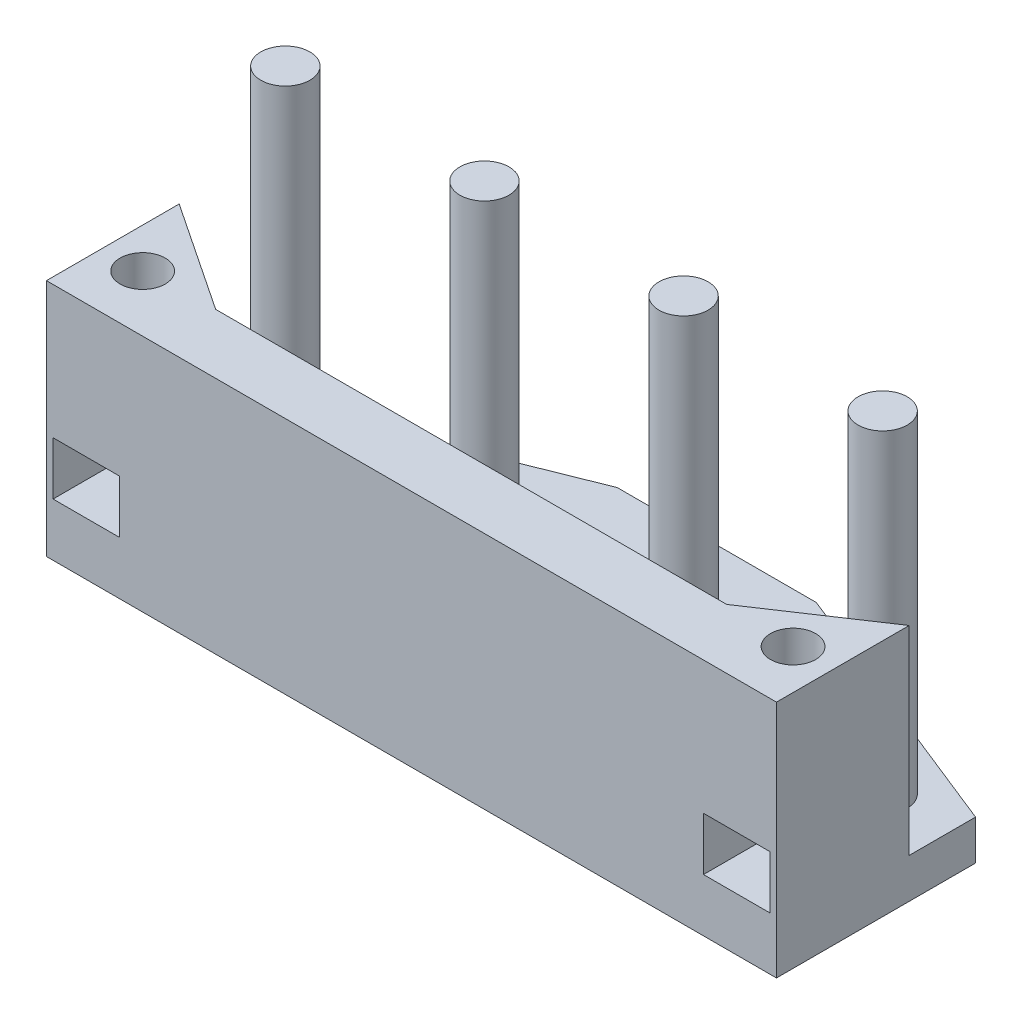
from build123d import *

# Parameters (mm, degrees)
BOSS_EXTRUDE1_DEPTH = 3
SKETCH2_R           = 1.85
BOSS_EXTRUDE2_DEPTH = 25
BOSS_EXTRUDE3_DEPTH = 15
SKETCH4_R           = 1.7
CUT_EXTRUDE1_DEPTH  = 10
CUT_EXTRUDE2_START  = -10
CUT_EXTRUDE2_DEPTH  = 4


with BuildPart() as part:
    # Sketch1 → Boss-Extrude1 (new body)
    with BuildSketch(Plane(origin=(0, 0, 0), x_dir=(1, 0, 0), z_dir=(0, 1, 0))):
        Polygon((0, 0), (55, 0), (55, 15), (35, 23), (20, 23), (0, 15), align=None)
    extrude(amount=BOSS_EXTRUDE1_DEPTH)

    # Sketch2 → Boss-Extrude2 (add)
    with BuildSketch(Plane(origin=(0, 3, 0), x_dir=(1, 0, 0), z_dir=(0, 1, 0))):
        with Locations((35, 13)):
            Circle(SKETCH2_R)
        with Locations((20, 13)):
            Circle(SKETCH2_R)
        with Locations((5, 13)):
            Circle(SKETCH2_R)
        with Locations((50, 13)):
            Circle(SKETCH2_R)
    extrude(amount=BOSS_EXTRUDE2_DEPTH)

    # Sketch3 → Boss-Extrude3 (add)
    with BuildSketch(Plane(origin=(0, 3, 0), x_dir=(1, 0, 0), z_dir=(0, 1, 0))):
        Polygon((0, 10), (0, 0), (55, 0), (55, 10), (46.75, 4.5), (8.25, 4.5), align=None)
    extrude(amount=BOSS_EXTRUDE3_DEPTH)

    # Sketch4 → Cut-Extrude1 (cut)
    with BuildSketch(Plane(origin=(0, 18, 0), x_dir=(1, 0, 0), z_dir=(0, 1, 0))):
        with Locations((3, 4.25)):
            Circle(SKETCH4_R)
        with Locations((52, 4.25)):
            Circle(SKETCH4_R)
    extrude(amount=-CUT_EXTRUDE1_DEPTH, mode=Mode.SUBTRACT)

    # Sketch6 → Cut-Extrude2 (cut)
    with BuildSketch(Plane(origin=(0, 18, 0), x_dir=(1, 0, 0), z_dir=(0, 1, 0)).offset(CUT_EXTRUDE2_START)):
        Polygon((49.5, 0), (54.5, 0), (54.5, 5.693375673), (52, 7.136751346), (49.5, 5.693375673), align=None)
        Polygon((5.5, 0), (5.5, 5.693375673), (3, 7.136751346), (0.5, 5.693375673), (0.5, 0), align=None)
    extrude(amount=-CUT_EXTRUDE2_DEPTH, mode=Mode.SUBTRACT)


solid = part.part
